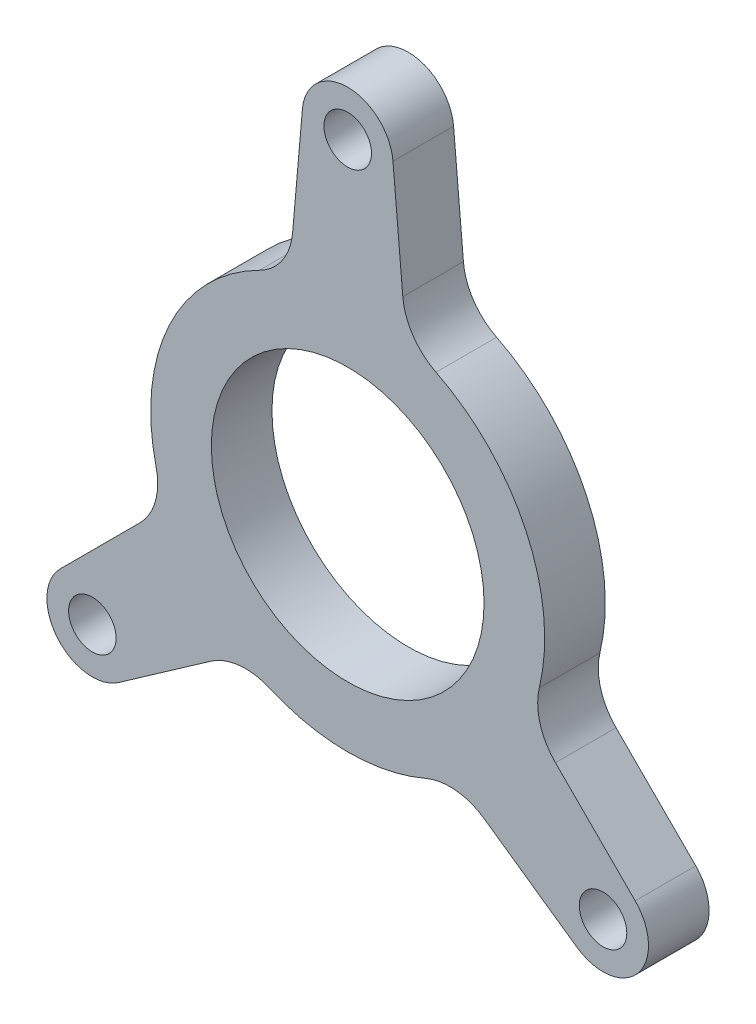
from build123d import *

# Parameters (mm, degrees)
SKETCH1_R           = 2.4892
SKETCH1_R_2         = 14.2875
BOSS_EXTRUDE1_DEPTH = 3.175
FILLET1_R           = 6.35


with BuildPart() as part:
    # Sketch1 → Boss-Extrude1 (new, symmetric)
    with BuildSketch(Plane.XY):
        with BuildLine():
            Line((6.111677291, 19.711768235), (4.74437725, 35.340079225))
            ThreePointArc((4.74437725, 35.340079225), (0, 39.6875), (-4.74437725, 35.340079225))
            Line((-4.74437725, 35.340079225), (-6.111677291, 19.711768235))
            ThreePointArc((-6.111677291, 19.711768235), (-18.703926955, 8.721784377), (-19.028600957, -7.988663959))
            Line((-19.028600957, -7.988663959), (-30.121698221, -19.081761223))
            ThreePointArc((-30.121698221, -19.081761223), (-30.402388836, -25.510633259), (-24.022444398, -26.350568879))
            Line((-24.022444398, -26.350568879), (-11.171580083, -17.352296813))
            ThreePointArc((-11.171580083, -17.352296813), (0, -20.6375), (11.171580083, -17.352296813))
            Line((11.171580083, -17.352296813), (24.022444398, -26.350568879))
            ThreePointArc((24.022444398, -26.350568879), (30.402388836, -25.510633259), (30.121698221, -19.081761223))
            Line((30.121698221, -19.081761223), (19.028600957, -7.988663959))
            ThreePointArc((19.028600957, -7.988663959), (18.703926955, 8.721784377), (6.111677291, 19.711768235))
        make_face()
        with Locations((0, 34.925)):
            Circle(SKETCH1_R, mode=Mode.SUBTRACT)
        Circle(SKETCH1_R_2, mode=Mode.SUBTRACT)
        with Locations((26.754102176, -22.449357268)):
            Circle(SKETCH1_R, mode=Mode.SUBTRACT)
        with Locations((-26.754102176, -22.449357268)):
            Circle(SKETCH1_R, mode=Mode.SUBTRACT)
    extrude(amount=BOSS_EXTRUDE1_DEPTH, both=True)

    # Fillet1
    fillet1_edges = [part.edges().sort_by_distance(p)[0] for p in [
        (19.028600957, -7.988663959, 0),
        (11.171580083, -17.352296813, 0),
        (-11.171580083, -17.352296813, 0),
        (-19.028600957, -7.988663959, 0),
        (-6.111677291, 19.711768235, 0),
        (6.111677291, 19.711768235, 0),
    ]]
    fillet(fillet1_edges, radius=FILLET1_R)


solid = part.part
